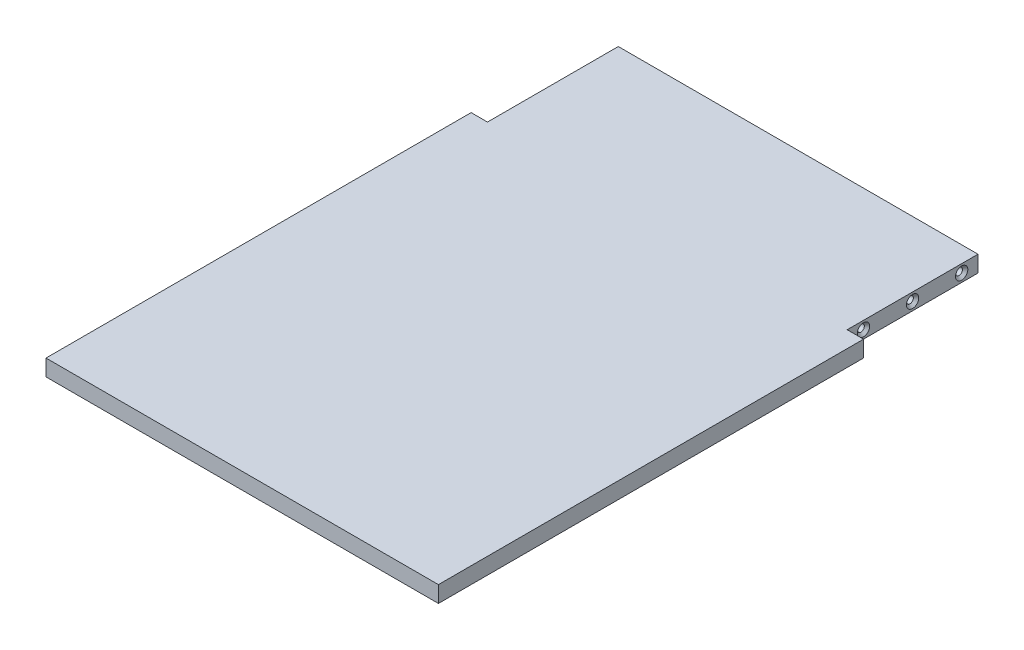
from build123d import *

# Parameters (mm, degrees)
BOSS_EXTRUDE1_DEPTH             = 6.35
F_6_32_TAPPED_HOLE1_D           = 2.7051
F_6_32_TAPPED_HOLE1_DEPTH       = 11.88730597
F_6_32_TAPPED_HOLE1_CSINK_D     = 4.7752
F_6_32_TAPPED_HOLE1_CSINK_ANGLE = 90
F_6_32_TAPPED_HOLE1_TIP         = 0.81269403
F_6_32_TAPPED_HOLE2_D           = 2.7051
F_6_32_TAPPED_HOLE2_DEPTH       = 11.88730597
F_6_32_TAPPED_HOLE2_CSINK_D     = 4.7752
F_6_32_TAPPED_HOLE2_CSINK_ANGLE = 90
F_6_32_TAPPED_HOLE2_TIP         = 0.81269403


with BuildPart() as part:
    # Sketch1 → Boss-Extrude1 (new body)
    with BuildSketch(Plane(origin=(0, 0, 0), x_dir=(1, 0, 0), z_dir=(0, 1, 0))):
        Polygon((-6.35, 0), (-6.35, -50.8), (0, -50.8), (0, -215.9), (-152.4, -215.9), (-152.4, -50.8), (-146.05, -50.8), (-146.05, 0), align=None)
    extrude(amount=BOSS_EXTRUDE1_DEPTH)

    # #6-32 Tapped Hole1
    with Locations(Plane(origin=(-6.35, 0, 0), x_dir=(0, 0, -1), z_dir=(1, 0, 0))):
        with Locations((-44.45, 3.175), (-25.4, 3.175), (-6.35, 3.175)):
            CounterSinkHole(F_6_32_TAPPED_HOLE1_D / 2, F_6_32_TAPPED_HOLE1_CSINK_D / 2, depth=F_6_32_TAPPED_HOLE1_DEPTH, counter_sink_angle=F_6_32_TAPPED_HOLE1_CSINK_ANGLE)
            with Locations((0, 0, -(F_6_32_TAPPED_HOLE1_DEPTH + F_6_32_TAPPED_HOLE1_TIP / 2))):  # 118° drill point
                Cone(0, F_6_32_TAPPED_HOLE1_D / 2, F_6_32_TAPPED_HOLE1_TIP, mode=Mode.SUBTRACT)

    # #6-32 Tapped Hole2
    with Locations(Plane.ZY.offset(146.05)):
        with Locations((6.35, 3.175), (25.4, 3.175), (44.45, 3.175)):
            CounterSinkHole(F_6_32_TAPPED_HOLE2_D / 2, F_6_32_TAPPED_HOLE2_CSINK_D / 2, depth=F_6_32_TAPPED_HOLE2_DEPTH, counter_sink_angle=F_6_32_TAPPED_HOLE2_CSINK_ANGLE)
            with Locations((0, 0, -(F_6_32_TAPPED_HOLE2_DEPTH + F_6_32_TAPPED_HOLE2_TIP / 2))):  # 118° drill point
                Cone(0, F_6_32_TAPPED_HOLE2_D / 2, F_6_32_TAPPED_HOLE2_TIP, mode=Mode.SUBTRACT)


solid = part.part
